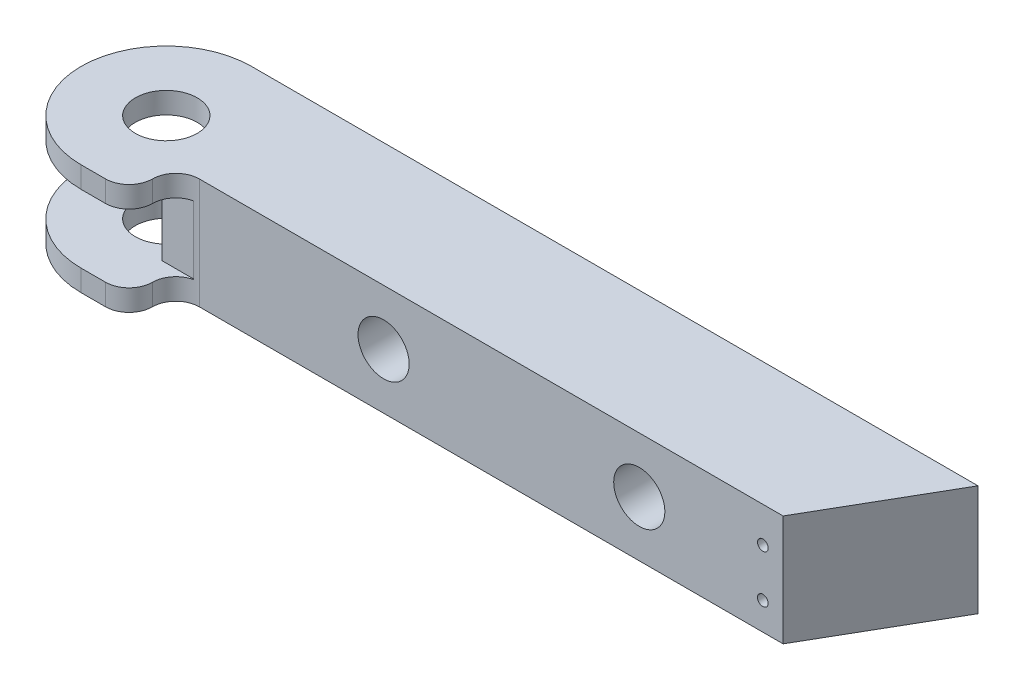
from build123d import *

# Parameters (mm, degrees)
SKETCH1_W                  = 38.1
SKETCH1_H                  = 8
BOSS_EXTRUDE1_DEPTH        = 5.2
FILLET1_R                  = 4
SKETCH3_R                  = 1.45
CUT_EXTRUDE1_DEPTH         = 5.2
SKETCH4_W                  = 31.85
SKETCH4_H                  = 2.2
CUT_EXTRUDE2_DEPTH         = 5.2
FILLET2_R                  = 1.1
FILLET3_R                  = 1.1
CUT_EXTRUDE3_DEPTH         = 5.2
CUT_EXTRUDE4_START         = -9.612880748
CUT_EXTRUDE4_OUTLINE_W     = 3.2
CUT_EXTRUDE4_OUTLINE_H     = 11
CUT_EXTRUDE4_DEPTH         = 4
SKETCH8_W                  = 3.1
SKETCH8_H                  = 2.2
CUT_EXTRUDE5_DEPTH         = 3.2
SKETCH9_R                  = 2.4
CUT_EXTRUDE6_DEPTH         = 3.2
M2_CLEARANCE_HOLE1_D       = 2.4
F_0_5_0_5_DIAMETER_HOLE1_D = 0.5


# Read off the part's stored shape, not the designer's step: Cut-Extrude4
with BuildPart() as part:
    # Sketch1 → Boss-Extrude1 (new body)
    with BuildSketch(Plane(origin=(0, 0, 0), x_dir=(1, 0, 0), z_dir=(0, 1, 0))):
        with Locations((9.437119252, 0.097413434)):
            Rectangle(SKETCH1_W, SKETCH1_H)
    extrude(amount=BOSS_EXTRUDE1_DEPTH)

    # Fillet1
    fillet1_edges = [part.edges().sort_by_distance(p)[0] for p in [
        (-9.612880748, 2.6, -4.097413434),
        (-9.612880748, 2.6, 3.902586566),
    ]]
    fillet(fillet1_edges, radius=FILLET1_R - 0.0001)  # a hair under: the kernel refuses the full size

    # Sketch3 → Cut-Extrude1 (cut)
    with BuildSketch(Plane(origin=(0, 5.2, 0), x_dir=(1, 0, 0), z_dir=(0, 1, 0))):
        with Locations(Location((-5.612880748, 0.097413434, 0), (0, 0, 270))):
            Circle(SKETCH3_R)
    extrude(amount=-CUT_EXTRUDE1_DEPTH, mode=Mode.SUBTRACT)

    # Sketch4 → Cut-Extrude2 (cut)
    with BuildSketch(Plane(origin=(0, 5.2, 0), x_dir=(1, 0, 0), z_dir=(0, 1, 0))):
        with Locations((12.562119252, -2.802586566)):
            Rectangle(SKETCH4_W, SKETCH4_H)
    extrude(amount=-CUT_EXTRUDE2_DEPTH, mode=Mode.SUBTRACT)

    # Fillet2
    fillet2_edges = [part.edges().sort_by_distance(p)[0] for p in [
        (-3.362880748, 2.6, 1.702586566),
    ]]
    fillet(fillet2_edges, radius=FILLET2_R)

    # Fillet3
    fillet3_edges = [part.edges().sort_by_distance(p)[0] for p in [
        (-3.362880748, 2.6, 3.902586566),
    ]]
    fillet(fillet3_edges, radius=FILLET3_R - 0.0001)  # a hair under: the kernel refuses the full size

    # Sketch5 → Cut-Extrude3 (cut)
    with BuildSketch(Plane(origin=(0, 5.2, 0), x_dir=(1, 0, 0), z_dir=(0, 1, 0))):
        Polygon((28.487119252, 4.097413434), (25.138487691, -1.702586566), (28.487119252, -1.702586566), align=None)
    extrude(amount=-CUT_EXTRUDE3_DEPTH, mode=Mode.SUBTRACT)

    # Cut-Extrude4 outline → Cut-Extrude4 (cut)
    with BuildSketch(Plane.YZ.offset(CUT_EXTRUDE4_START)):
        with Locations((2.6, -0.5)):
            Rectangle(CUT_EXTRUDE4_OUTLINE_W, CUT_EXTRUDE4_OUTLINE_H)
    extrude(amount=CUT_EXTRUDE4_DEPTH, mode=Mode.SUBTRACT)

    # Sketch8 → Cut-Extrude5 (cut)
    with BuildSketch(Plane.XZ.offset(-4.2)):
        with Locations((-4.062880748, 2.802586566)):
            Rectangle(SKETCH8_W, SKETCH8_H)
    extrude(amount=CUT_EXTRUDE5_DEPTH, mode=Mode.SUBTRACT)

    # Sketch9 → Cut-Extrude6 (cut)
    with BuildSketch(Plane.XZ.offset(-4.2)):
        with Locations((-5.612880748, -0.097413434)):
            Circle(SKETCH9_R)
    extrude(amount=CUT_EXTRUDE6_DEPTH, mode=Mode.SUBTRACT)

    # M2 Clearance Hole1 (through all)
    with Locations(Plane(origin=(6.387119252, 2.6, -4.097413434), x_dir=(-1, 0, 0), z_dir=(0, 0, -1))):
        with Locations((0, 0), (-12, 0)):
            Hole(M2_CLEARANCE_HOLE1_D / 2)

    # Ø0.5 (0.5) Diameter Hole1 (through all)
    with Locations(Plane(origin=(24.187119252, 3.539440359, -4.097413434), x_dir=(-1, 0, 0), z_dir=(0, 0, -1))):
        with Locations((0, 0), (0, -2.246762327)):
            Hole(F_0_5_0_5_DIAMETER_HOLE1_D / 2)


solid = part.part
